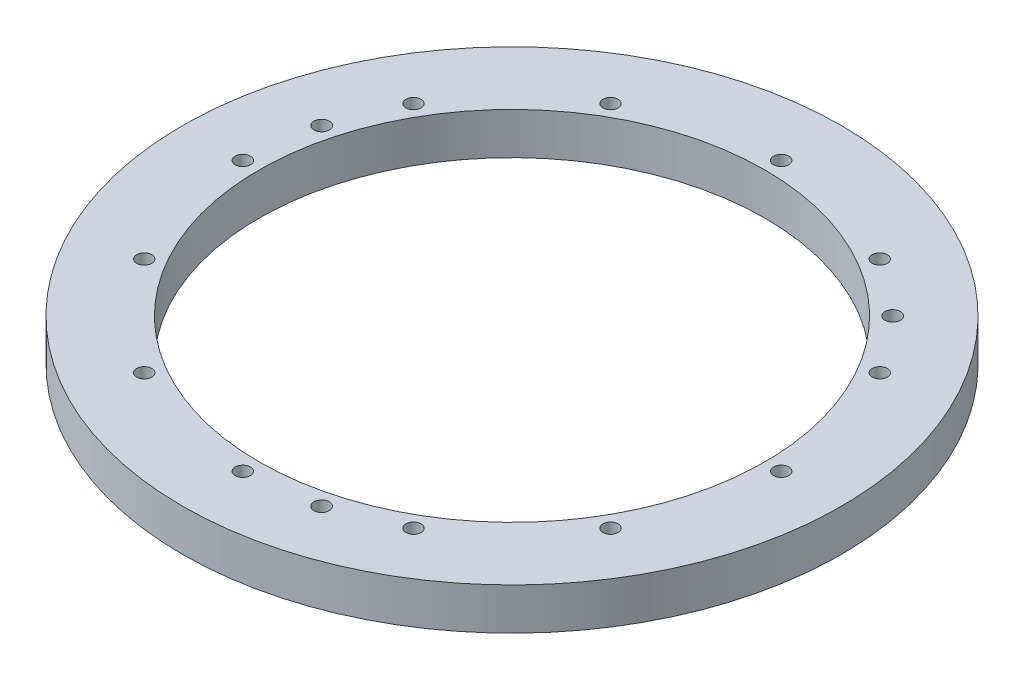
from build123d import *

# Parameters (mm, degrees)
SKETCH1_R           = 64.135
SKETCH1_R_2         = 1.4732
SKETCH1_R_3         = 49.2125
BOSS_EXTRUDE1_DEPTH = 8.128
SKETCH2_R           = 1.500000048
CUT_EXTRUDE1_DEPTH  = 92.064047977
CIRPATTERN1_COUNT   = 3


with BuildPart() as part:
    # Sketch1 → Boss-Extrude1 (new body)
    with BuildSketch(Plane(origin=(0, 0, 0), x_dir=(1, 0, 0), z_dir=(0, 1, 0))):
        Circle(SKETCH1_R)
        with Locations((-26.19375, -45.368905841)):
            Circle(SKETCH1_R_2, mode=Mode.SUBTRACT)
        with Locations((-45.368905841, -26.19375)):
            Circle(SKETCH1_R_2, mode=Mode.SUBTRACT)
        with Locations((0, -52.3875)):
            Circle(SKETCH1_R_2, mode=Mode.SUBTRACT)
        with Locations((26.19375, -45.368905841)):
            Circle(SKETCH1_R_2, mode=Mode.SUBTRACT)
        with Locations((45.368905841, -26.19375)):
            Circle(SKETCH1_R_2, mode=Mode.SUBTRACT)
        with Locations((52.3875, 0)):
            Circle(SKETCH1_R_2, mode=Mode.SUBTRACT)
        with Locations((-52.3875, 0)):
            Circle(SKETCH1_R_2, mode=Mode.SUBTRACT)
        with Locations((-45.368905841, 26.19375)):
            Circle(SKETCH1_R_2, mode=Mode.SUBTRACT)
        with Locations((-26.19375, 45.368905841)):
            Circle(SKETCH1_R_2, mode=Mode.SUBTRACT)
        Circle(SKETCH1_R_3, mode=Mode.SUBTRACT)
        with Locations((45.368905841, 26.19375)):
            Circle(SKETCH1_R_2, mode=Mode.SUBTRACT)
        with Locations((26.19375, 45.368905841)):
            Circle(SKETCH1_R_2, mode=Mode.SUBTRACT)
        with Locations((0, 52.3875)):
            Circle(SKETCH1_R_2, mode=Mode.SUBTRACT)
    extrude(amount=BOSS_EXTRUDE1_DEPTH)

    # Sketch2 → Cut-Extrude1 (cut, through all)
    with BuildSketch(Plane(origin=(0, 8.128, 0), x_dir=(1, 0, 0), z_dir=(0, 1, 0))):
        with Locations((-50.602439225, 13.558882725)):
            Circle(SKETCH2_R)
    cut_extrude1 = extrude(amount=-CUT_EXTRUDE1_DEPTH, mode=Mode.SUBTRACT)

    # CirPattern1: Cut-Extrude1 ×3 about axis
    cirpattern1_axis = Axis((0, 8.128, 0), (0, 1, 0))
    for i in range(1, CIRPATTERN1_COUNT):
        add(cut_extrude1.rotate(cirpattern1_axis, i * 360 / CIRPATTERN1_COUNT), mode=Mode.SUBTRACT)


solid = part.part
